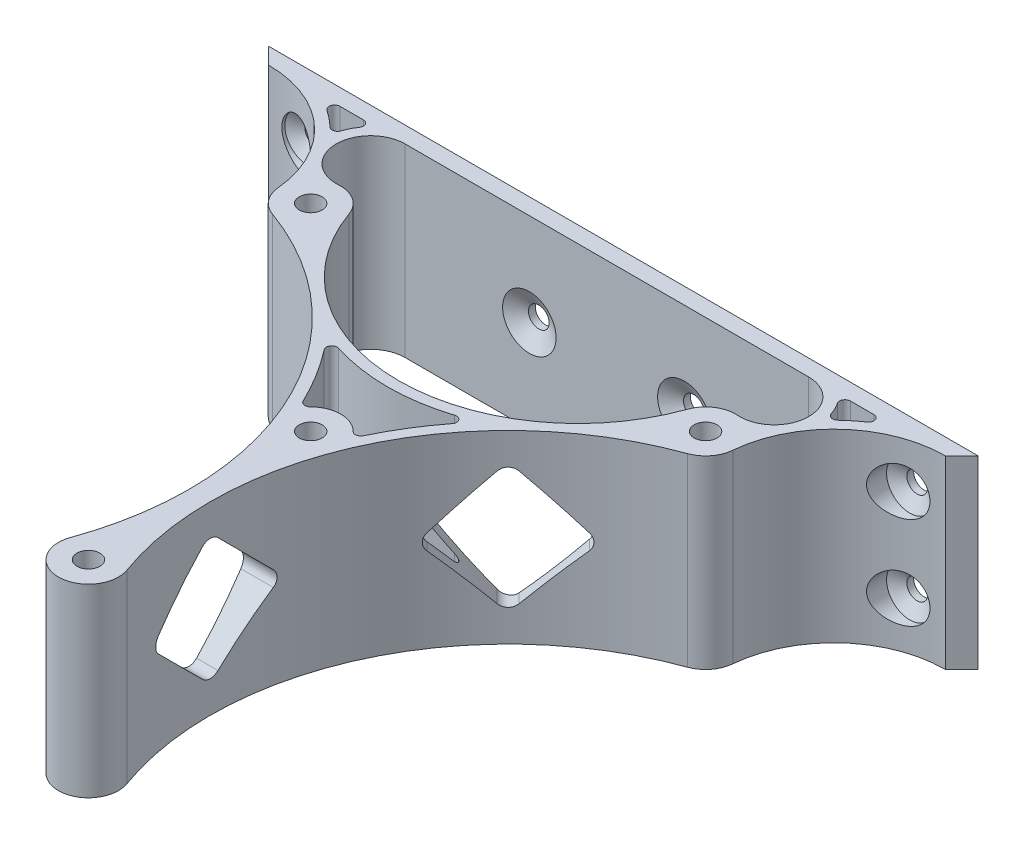
from build123d import *

# Parameters (mm, degrees)
BOSS_EXTRUDE1_DEPTH                 = 16.95
BOSS_EXTRUDE1_DEPTH_BACK            = 16.95
CUT_EXTRUDE1_DEPTH                  = 127.818047052
CUT_EXTRUDE1_DEPTH_BACK             = 127.818047052
SKETCH6_R                           = 2.1
FILLET2_R                           = 1
CUT_EXTRUDE2_REACH                  = 122.868
SKETCH7_R                           = 4.25
SKETCH8_R                           = 1.9
CUT_EXTRUDE3_DEPTH                  = 121.867759125
CUT_EXTRUDE4_REACH                  = 122.586
CUT_EXTRUDE4_DIRECTION_2_REACH      = 122.586
CUT_EXTRUDE5_REACH                  = 125.373
CUT_EXTRUDE5_END_RADIUS             = 54.589335915
CUT_EXTRUDE5_DIRECTION_2_REACH      = 125.373
CUT_EXTRUDE5_DIRECTION_2_END_RADIUS = 54.589335915
CUT_EXTRUDE6_REACH                  = 122.868
SKETCH13_R                          = 1.9
CHAMFER1_SIZE                       = 3
CHAMFER1_SIZE_2                     = 1.732050808
FILLET1_R                           = 2


with BuildPart() as part:
    # Sketch5 → Boss-Extrude1 (new, two sides: drawn at the far end of the back side and taken through both)
    with BuildSketch(Plane(origin=(0, 0, 0), x_dir=(1, 0, 0), z_dir=(0, 1, 0)).offset(-BOSS_EXTRUDE1_DEPTH_BACK)):
        with BuildLine():
            Line((-65, 0), (-62, -3))
            ThreePointArc((-62, -3), (-48.221297355, -8.345398221), (-41.652411979, -21.584570161))
            ThreePointArc((-41.652411979, -21.584570161), (-40.527236138, -24.450105254), (-38.038482526, -26.262125534))
            ThreePointArc((-38.038482526, -26.262125534), (-7.138773855, -54.384163302), (-5.174663923, -96.118840446))
            ThreePointArc((-5.174663923, -96.118840446), (0, -103.48239975), (5.174663923, -96.118840446))
            ThreePointArc((5.174663923, -96.118840446), (7.138773855, -54.384163302), (38.038482526, -26.262125534))
            ThreePointArc((38.038482526, -26.262125534), (40.527236138, -24.450105254), (41.652411979, -21.584570161))
            ThreePointArc((41.652411979, -21.584570161), (48.221297355, -8.345398221), (62, -3))
            Line((62, -3), (65, 0))
            Line((65, 0), (-65, 0))
        make_face()
        with BuildLine():
            Line((-52.741228588, -3), (-42.37821905, -3))
            ThreePointArc((-42.37821905, -3), (-44.34612143, -5.482320176), (-45.241743763, -8.520808923))
            ThreePointArc((-45.241743763, -8.520808923), (-48.70183228, -5.366937666), (-52.741228588, -3))
        make_face(mode=Mode.SUBTRACT)
        with BuildLine():
            Line((42.37821905, -3), (52.741228588, -3))
            ThreePointArc((52.741228588, -3), (48.70183228, -5.366937666), (45.241743763, -8.520808923))
            ThreePointArc((45.241743763, -8.520808923), (44.34612143, -5.482320176), (42.37821905, -3))
        make_face(mode=Mode.SUBTRACT)
        with BuildLine():
            Line((36.971854849, -3), (-36.971854849, -3))
            ThreePointArc((-36.971854849, -3), (-43.275451533, -9.520168294), (-36.546148099, -15.600003903))
            ThreePointArc((-36.546148099, -15.600003903), (-33.153471619, -16.491721168), (-30.989893022, -19.252942101))
            ThreePointArc((-30.989893022, -19.252942101), (0, -41.160789094), (30.989893022, -19.252942101))
            ThreePointArc((30.989893022, -19.252942101), (33.153471619, -16.491721168), (36.546148099, -15.600003903))
            ThreePointArc((36.546148099, -15.600003903), (43.275451533, -9.520168294), (36.971854849, -3))
        make_face(mode=Mode.SUBTRACT)
        with BuildLine():
            ThreePointArc((14.10133264, -40.182537902), (8.913747252, -47.051559325), (4.827997834, -54.627913933))
            ThreePointArc((4.827997834, -54.627913933), (0, -51.762384832), (-4.827997834, -54.627913933))
            ThreePointArc((-4.827997834, -54.627913933), (-8.913747252, -47.051559325), (-14.10133264, -40.182537902))
            ThreePointArc((-14.10133264, -40.182537902), (0, -43.160789094), (14.10133264, -40.182537902))
        make_face(mode=Mode.SUBTRACT)
    extrude(amount=BOSS_EXTRUDE1_DEPTH + BOSS_EXTRUDE1_DEPTH_BACK)

    # Sketch6 → Cut-Extrude1 (cut, two sides: drawn at the far end of the back side and taken through both)
    with BuildSketch(Plane(origin=(0, 16.95, 0), x_dir=(1, 0, 0), z_dir=(0, 1, 0)).offset(-CUT_EXTRUDE1_DEPTH_BACK)):
        with Locations(Location((36.174923221, -21.087461611, 0), (0, 0, 270))):
            Circle(SKETCH6_R)
        with Locations(Location((-36.174923221, -21.087461611, 0), (0, 0, 270))):
            Circle(SKETCH6_R)
        with Locations(Location((0, -57.262384832, 0), (0, 0, 270))):
            Circle(SKETCH6_R)
        with Locations(Location((0, -97.98239975, 0), (0, 0, 270))):
            Circle(SKETCH6_R)
    extrude(amount=CUT_EXTRUDE1_DEPTH + CUT_EXTRUDE1_DEPTH_BACK, mode=Mode.SUBTRACT)

    # Fillet2
    fillet2_edges = [part.edges().sort_by_distance(p)[0] for p in [
        (4.827997834, 0, 54.627913933),
        (14.10133264, 0, 40.182537902),
        (-14.10133264, 0, 40.182537902),
        (-4.827997834, 0, 54.627913933),
        (-42.37821905, 0, 3),
        (-52.741228588, 0, 3),
        (-45.241743763, 0, 8.520808923),
        (45.241743763, 0, 8.520808923),
        (52.741228588, 0, 3),
        (42.37821905, 0, 3),
    ]]
    fillet(fillet2_edges, radius=FILLET2_R)

    # Sketch7 → Cut-Extrude2 (cut, up to next)
    with BuildSketch(Plane.XY.offset(3), mode=Mode.PRIVATE) as cut_extrude2_sk1:
        with Locations(Location((-55.120871881, 8.475, 0), (0, 0, 180))):
            Circle(SKETCH7_R)
    cut_extrude2_tool1 = extrude(cut_extrude2_sk1.sketch, amount=CUT_EXTRUDE2_REACH, mode=Mode.PRIVATE) & part.part
    # Sketch7 → Cut-Extrude2 (cut, up to next)
    with BuildSketch(Plane.XY.offset(3), mode=Mode.PRIVATE) as cut_extrude2_sk2:
        with Locations(Location((-55.120871881, -8.475, 0), (0, 0, 180))):
            Circle(SKETCH7_R)
    cut_extrude2_tool2 = extrude(cut_extrude2_sk2.sketch, amount=CUT_EXTRUDE2_REACH, mode=Mode.PRIVATE) & part.part
    # Sketch7 → Cut-Extrude2 (cut, up to next)
    with BuildSketch(Plane.XY.offset(3), mode=Mode.PRIVATE) as cut_extrude2_sk3:
        with Locations(Location((55.120871881, -8.475, 0), (0, 0, 180))):
            Circle(SKETCH7_R)
    cut_extrude2_tool3 = extrude(cut_extrude2_sk3.sketch, amount=CUT_EXTRUDE2_REACH, mode=Mode.PRIVATE) & part.part
    # Sketch7 → Cut-Extrude2 (cut, up to next)
    with BuildSketch(Plane.XY.offset(3), mode=Mode.PRIVATE) as cut_extrude2_sk4:
        with Locations(Location((55.120871881, 8.475, 0), (0, 0, 180))):
            Circle(SKETCH7_R)
    cut_extrude2_tool4 = extrude(cut_extrude2_sk4.sketch, amount=CUT_EXTRUDE2_REACH, mode=Mode.PRIVATE) & part.part
    add(cut_extrude2_tool1.solids().sort_by_distance((-55.120872, 8.475, 3))[0], mode=Mode.SUBTRACT)
    add(cut_extrude2_tool2.solids().sort_by_distance((-55.120872, -8.475, 3))[0], mode=Mode.SUBTRACT)
    add(cut_extrude2_tool3.solids().sort_by_distance((55.120872, -8.475, 3))[0], mode=Mode.SUBTRACT)
    add(cut_extrude2_tool4.solids().sort_by_distance((55.120872, 8.475, 3))[0], mode=Mode.SUBTRACT)

    # Sketch8 → Cut-Extrude3 (cut, through all)
    with BuildSketch(Plane.XY.offset(3)):
        with Locations((55.120871881, -8.475)):
            Circle(SKETCH8_R)
        with Locations((55.120871881, 8.475)):
            Circle(SKETCH8_R)
        with Locations((-55.120871881, -8.475)):
            Circle(SKETCH8_R)
        with Locations((-55.120871881, 8.475)):
            Circle(SKETCH8_R)
    extrude(amount=-CUT_EXTRUDE3_DEPTH, mode=Mode.SUBTRACT)

    # Sketch10 → Cut-Extrude4 (cut, up to next)
    with BuildSketch(Plane(origin=(24.74210512, 0, 24.74210512), x_dir=(-0.7071067811865476, 0, 0.7071067811865475), z_dir=(-0.7071067811865475, 0, -0.7071067811865476)), mode=Mode.PRIVATE) as cut_extrude4_sk1:
        Polygon((14.911087103, -11.95), (26.861087103, 0), (14.911087103, 11.95), (2.961087103, 0), align=None)
    cut_extrude4_tool1 = extrude(cut_extrude4_sk1.sketch, amount=-CUT_EXTRUDE4_REACH, mode=Mode.PRIVATE) & part.part
    cut_extrude4 = cut_extrude4_tool1.solids().sort_by_distance((14.198374, 0, 35.285836))[0]
    add(cut_extrude4, mode=Mode.SUBTRACT)

    # Sketch10 → Cut-Extrude4 direction 2 (cut, up to next)
    with BuildSketch(Plane(origin=(24.74210512, 0, 24.74210512), x_dir=(-0.7071067811865476, 0, 0.7071067811865475), z_dir=(-0.7071067811865475, 0, -0.7071067811865476)), mode=Mode.PRIVATE) as cut_extrude4_direction_2_sk1:
        Polygon((14.911087103, -11.95), (26.861087103, 0), (14.911087103, 11.95), (2.961087103, 0), align=None)
    cut_extrude4_direction_2_tool1 = extrude(cut_extrude4_direction_2_sk1.sketch, amount=CUT_EXTRUDE4_DIRECTION_2_REACH, mode=Mode.PRIVATE) & part.part
    cut_extrude4_direction_2 = cut_extrude4_direction_2_tool1.solids().sort_by_distance((14.198374, 0, 35.285836))[0]
    add(cut_extrude4_direction_2, mode=Mode.SUBTRACT)

    # Mirror1: Cut-Extrude4, Cut-Extrude4 direction 2 across plane
    add(cut_extrude4.mirror(Plane(origin=(0, 0, 0), x_dir=(0, 0, 1), z_dir=(1, 0, 0))), mode=Mode.SUBTRACT)
    add(cut_extrude4_direction_2.mirror(Plane(origin=(0, 0, 0), x_dir=(0, 0, 1), z_dir=(1, 0, 0))), mode=Mode.SUBTRACT)

    # Cut-Extrude5: up to this cylinder (the profile starts outside it)
    cut_extrude5_end = Plane(origin=(-56.53493068, 0, 77.622392291), z_dir=(0, -1, 0)) * Cylinder(CUT_EXTRUDE5_END_RADIUS, 360.924671831, mode=Mode.PRIVATE)
    # Sketch12 → Cut-Extrude5 (cut, up to the surface)
    with BuildSketch(Plane(origin=(0, 0, 0), x_dir=(0, 0, -1), z_dir=(1, 0, 0)), mode=Mode.PRIVATE) as cut_extrude5_sk1:
        Polygon((-77.622392291, -11.95), (-89.572392291, 0), (-77.622392291, 11.95), (-65.672392291, 0), align=None)
    cut_extrude5_tool1 = extrude(cut_extrude5_sk1.sketch, amount=-CUT_EXTRUDE5_REACH, mode=Mode.PRIVATE) - cut_extrude5_end
    add(cut_extrude5_tool1.solids().sort_by_distance((0, 0, 77.622392))[0], mode=Mode.SUBTRACT)

    # Cut-Extrude5 direction 2: up to this cylinder (the profile starts outside it)
    cut_extrude5_direction_2_end = Plane(origin=(56.53493068, 0, 77.622392291), z_dir=(0, -1, 0)) * Cylinder(CUT_EXTRUDE5_DIRECTION_2_END_RADIUS, 360.924671831, mode=Mode.PRIVATE)
    # Sketch12 → Cut-Extrude5 direction 2 (cut, up to the surface)
    with BuildSketch(Plane(origin=(0, 0, 0), x_dir=(0, 0, -1), z_dir=(1, 0, 0)), mode=Mode.PRIVATE) as cut_extrude5_direction_2_sk1:
        Polygon((-77.622392291, -11.95), (-89.572392291, 0), (-77.622392291, 11.95), (-65.672392291, 0), align=None)
    cut_extrude5_direction_2_tool1 = extrude(cut_extrude5_direction_2_sk1.sketch, amount=CUT_EXTRUDE5_DIRECTION_2_REACH, mode=Mode.PRIVATE) - cut_extrude5_direction_2_end
    add(cut_extrude5_direction_2_tool1.solids().sort_by_distance((0, 0, 77.622392))[0], mode=Mode.SUBTRACT)

    # Sketch13 → Cut-Extrude6 (cut, up to next)
    with BuildSketch(Plane.XY.offset(3), mode=Mode.PRIVATE) as cut_extrude6_sk1:
        with Locations((14.198374314, 0)):
            Circle(SKETCH13_R)
    cut_extrude6_tool1 = extrude(cut_extrude6_sk1.sketch, amount=-CUT_EXTRUDE6_REACH, mode=Mode.PRIVATE) & part.part
    # Sketch13 → Cut-Extrude6 (cut, up to next)
    with BuildSketch(Plane.XY.offset(3), mode=Mode.PRIVATE) as cut_extrude6_sk2:
        with Locations((-14.198374314, 0)):
            Circle(SKETCH13_R)
    cut_extrude6_tool2 = extrude(cut_extrude6_sk2.sketch, amount=-CUT_EXTRUDE6_REACH, mode=Mode.PRIVATE) & part.part
    add(cut_extrude6_tool1.solids().sort_by_distance((14.198374, 0, 3))[0], mode=Mode.SUBTRACT)
    add(cut_extrude6_tool2.solids().sort_by_distance((-14.198374, 0, 3))[0], mode=Mode.SUBTRACT)

    # Chamfer1
    # the kernel refuses this chamfer: 3, 1.732050808 mm, written as the material it takes off along each edge
    with BuildSketch(Plane(origin=(-14.198374314, 0, 3), x_dir=(1, 0, 0), z_dir=(0, -1, 0))) as chamfer1_piece_1:
        Polygon((1.9 + CHAMFER1_SIZE, 0), (1.9, -CHAMFER1_SIZE_2), (1.9, 0), align=None)
    revolve(axis=Axis((-14.198374314, 0, 3), (0, 0, 1)), mode=Mode.SUBTRACT)
    with BuildSketch(Plane(origin=(14.198374314, 0, 3), x_dir=(1, 0, 0), z_dir=(0, -1, 0))) as chamfer1_piece_2:
        Polygon((1.9 + CHAMFER1_SIZE, 0), (1.9, -CHAMFER1_SIZE_2), (1.9, 0), align=None)
    revolve(axis=Axis((14.198374314, 0, 3), (0, 0, 1)), mode=Mode.SUBTRACT)
    with BuildSketch(Plane(origin=(55.120871881, 8.475, 3), x_dir=(1, 0, 0), z_dir=(0, -1, 0))) as chamfer1_piece_3_section:
        Polygon((1.9, -CHAMFER1_SIZE_2), (1.9 + CHAMFER1_SIZE, 0), (1.9, 0), align=None)
    chamfer1_piece_3 = revolve(axis=Axis((55.120871881, 8.475, 3), (0, 0, 1)), mode=Mode.PRIVATE)
    chamfer1_piece_3 = chamfer1_piece_3 & Plane(origin=(55.120871881, 8.475, 1.947878369), x_dir=(-1, 0, 0), z_dir=(0, 0, -1)) * Cylinder(4.25, 20, mode=Mode.PRIVATE)
    add(chamfer1_piece_3, mode=Mode.SUBTRACT)
    with BuildSketch(Plane(origin=(55.120871881, -8.475, 3), x_dir=(1, 0, 0), z_dir=(0, -1, 0))) as chamfer1_piece_4_section:
        Polygon((1.9, -CHAMFER1_SIZE_2), (1.9 + CHAMFER1_SIZE, 0), (1.9, 0), align=None)
    chamfer1_piece_4 = revolve(axis=Axis((55.120871881, -8.475, 3), (0, 0, 1)), mode=Mode.PRIVATE)
    chamfer1_piece_4 = chamfer1_piece_4 & Plane(origin=(55.120871881, -8.475, 1.947878369), x_dir=(-1, 0, 0), z_dir=(0, 0, -1)) * Cylinder(4.25, 20, mode=Mode.PRIVATE)
    add(chamfer1_piece_4, mode=Mode.SUBTRACT)
    with BuildSketch(Plane(origin=(-55.120871881, 8.475, 3), x_dir=(1, 0, 0), z_dir=(0, -1, 0))) as chamfer1_piece_5_section:
        Polygon((1.9, -CHAMFER1_SIZE_2), (1.9 + CHAMFER1_SIZE, 0), (1.9, 0), align=None)
    chamfer1_piece_5 = revolve(axis=Axis((-55.120871881, 8.475, 3), (0, 0, 1)), mode=Mode.PRIVATE)
    chamfer1_piece_5 = chamfer1_piece_5 & Plane(origin=(-55.120871881, 8.475, 1.947878369), x_dir=(-1, 0, 0), z_dir=(0, 0, -1)) * Cylinder(4.25, 20, mode=Mode.PRIVATE)
    add(chamfer1_piece_5, mode=Mode.SUBTRACT)
    with BuildSketch(Plane(origin=(-55.120871881, -8.475, 3), x_dir=(1, 0, 0), z_dir=(0, -1, 0))) as chamfer1_piece_6_section:
        Polygon((1.9, -CHAMFER1_SIZE_2), (1.9 + CHAMFER1_SIZE, 0), (1.9, 0), align=None)
    chamfer1_piece_6 = revolve(axis=Axis((-55.120871881, -8.475, 3), (0, 0, 1)), mode=Mode.PRIVATE)
    chamfer1_piece_6 = chamfer1_piece_6 & Plane(origin=(-55.120871881, -8.475, 1.947878369), x_dir=(-1, 0, 0), z_dir=(0, 0, -1)) * Cylinder(4.25, 20, mode=Mode.PRIVATE)
    add(chamfer1_piece_6, mode=Mode.SUBTRACT)

    # Fillet1
    fillet1_edges = [part.edges().sort_by_distance(p)[0] for p in [
        (16.940447713, -11.95, 38.027909324),
        (3.934847742, 0, 41.922161423),
        (9.696703696, 0, 47.684017377),
        (16.940447713, 11.95, 38.027909324),
        (26.262337141, 0, 30.449946682),
        (0, 11.95, 77.622392291),
        (0, 0, 89.572392291),
        (0, 0, 65.672392291),
        (0, -11.95, 77.622392291),
        (-16.940447713, -11.95, 38.027909324),
        (-9.696703696, 0, 47.684017377),
        (-3.934847742, 0, 41.922161423),
        (-26.262337141, 0, 30.449946682),
        (-16.940447713, 11.95, 38.027909324),
    ]]
    fillet(fillet1_edges, radius=FILLET1_R)


solid = part.part
